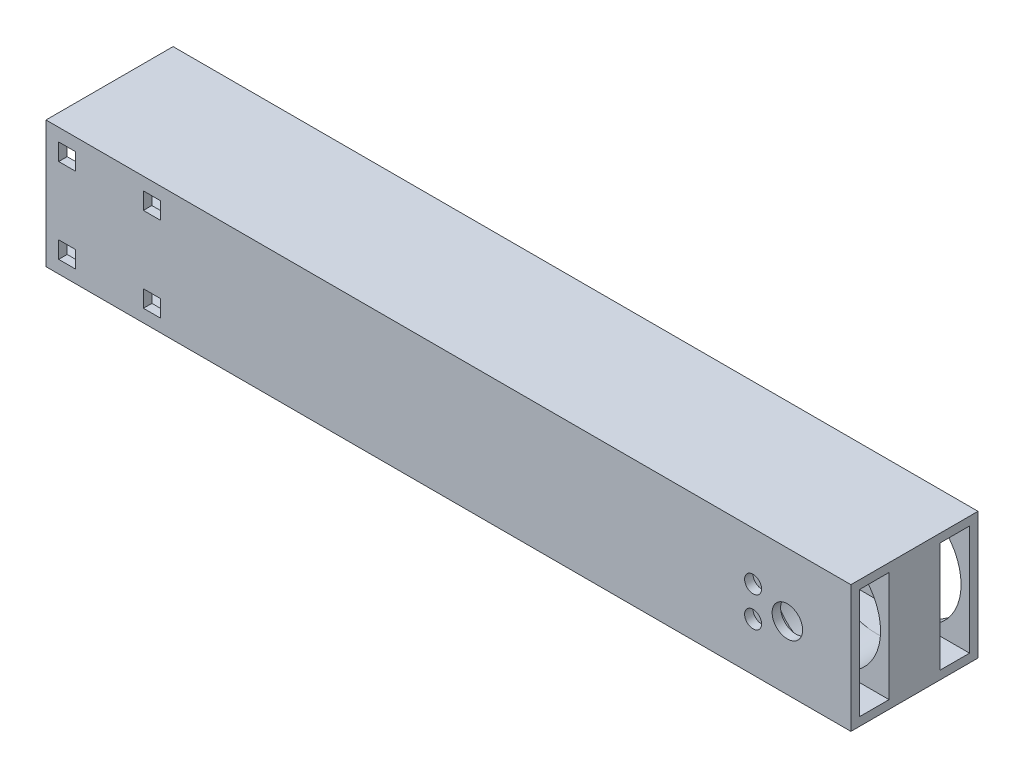
from build123d import *

# Parameters (mm, degrees)
BOSS_EXTRUDE3_DEPTH      = 110
BOSS_EXTRUDE3_DEPTH_BACK = 80
SKETCH1_W                = 30
SKETCH1_H                = 30
SKETCH1_W_2              = 7
SKETCH1_H_2              = 26
SKETCH6_R                = 13
CUT_EXTRUDE5_DEPTH       = 23
SKETCH8_R                = 3.6
SKETCH8_R_2              = 2
CUT_EXTRUDE6_DEPTH       = 17
SKETCH9_W                = 12
SKETCH9_H                = 26
CUT_EXTRUDE7_DEPTH       = 106
SKETCH12_W               = 4
SKETCH12_H               = 4
SKETCH12_W_2             = 4.027296216
CUT_EXTRUDE8_DEPTH       = 40


with BuildPart() as part:
    # Sketch1 → Boss-Extrude3 (new, two sides: drawn at the far end of the back side and taken through both)
    with BuildSketch(Plane(origin=(0, 0, 0), x_dir=(0, 0, -1), z_dir=(1, 0, 0)).offset(-BOSS_EXTRUDE3_DEPTH_BACK)):
        Rectangle(SKETCH1_W, SKETCH1_H)
        with Locations((-9.5, 0)):
            Rectangle(SKETCH1_W_2, SKETCH1_H_2, mode=Mode.SUBTRACT)
        with Locations((9.5, 0)):
            Rectangle(SKETCH1_W_2, SKETCH1_H_2, mode=Mode.SUBTRACT)
    extrude(amount=BOSS_EXTRUDE3_DEPTH + BOSS_EXTRUDE3_DEPTH_BACK)

    # Sketch6 → Cut-Extrude5 (cut)
    with BuildSketch(Plane(origin=(0, 0, -15), x_dir=(-1, 0, 0), z_dir=(0, 0, -1))):
        with Locations((-95, 0)):
            Circle(SKETCH6_R)
    extrude(amount=-CUT_EXTRUDE5_DEPTH, mode=Mode.SUBTRACT)

    # Sketch8 → Cut-Extrude6 (cut)
    with BuildSketch(Plane.XY.offset(15)):
        with Locations((95, 0)):
            Circle(SKETCH8_R)
        with Locations((86.906938117, 3.581179883)):
            Circle(SKETCH8_R_2)
        with Locations((86.906938117, -3.581179883)):
            Circle(SKETCH8_R_2)
    extrude(amount=-CUT_EXTRUDE6_DEPTH, mode=Mode.SUBTRACT)

    # Sketch9 → Cut-Extrude7 (cut)
    with BuildSketch(Plane.ZY.offset(80)):
        Rectangle(SKETCH9_W, SKETCH9_H)
    extrude(amount=-CUT_EXTRUDE7_DEPTH, mode=Mode.SUBTRACT)

    # Sketch12 → Cut-Extrude8 (cut)
    with BuildSketch(Plane.XY.offset(15)):
        with Locations((-75, 10)):
            Rectangle(SKETCH12_W, SKETCH12_H)
        with Locations((-55, 10)):
            Rectangle(SKETCH12_W_2, SKETCH12_H)
        with Locations((-55, -10)):
            Rectangle(SKETCH12_W, SKETCH12_H)
        with Locations((-75, -10)):
            Rectangle(SKETCH12_W, SKETCH12_H)
    extrude(amount=-CUT_EXTRUDE8_DEPTH, mode=Mode.SUBTRACT)


solid = part.part
